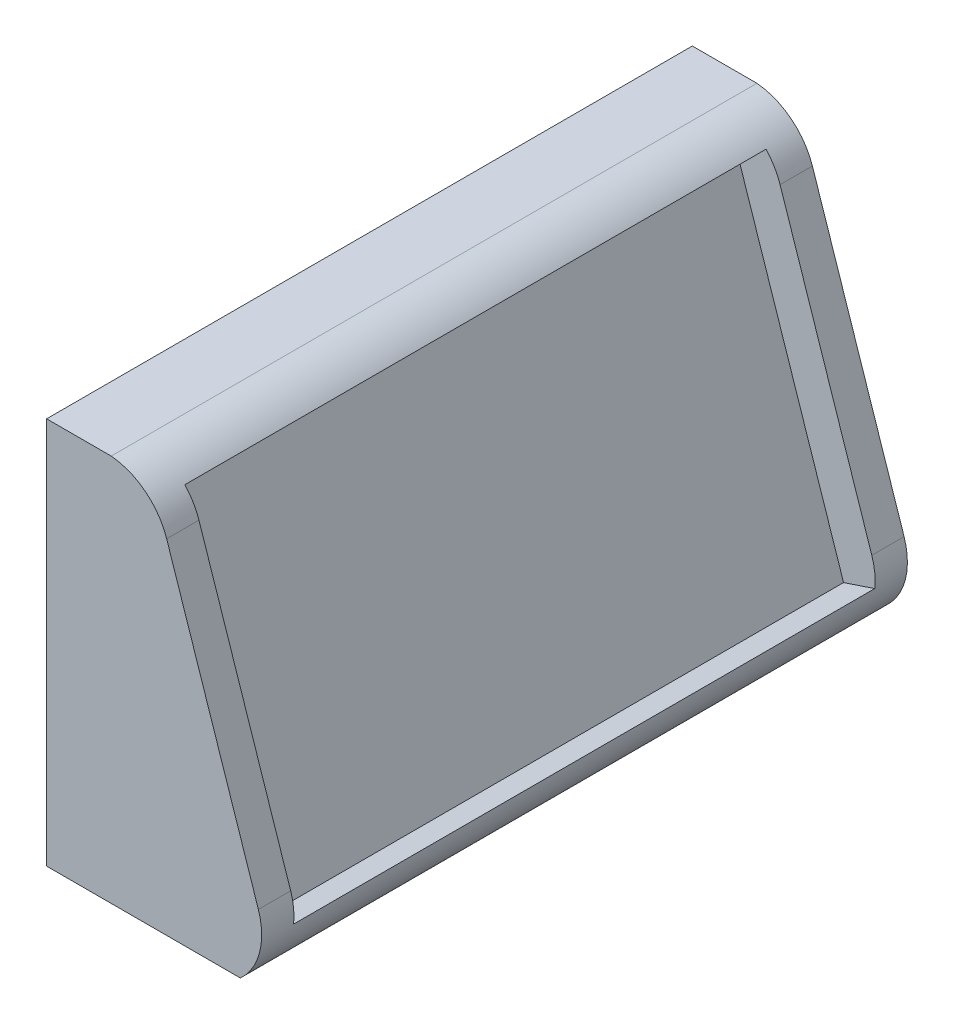
from build123d import *

# Parameters (mm, degrees)
SKETCH1_W           = 100
SKETCH1_H           = 60
BOSS_EXTRUDE1_DEPTH = 10
BOSS_EXTRUDE2_DEPTH = 100
SKETCH3_W           = 100
SKETCH3_H           = 63.245553203
SKETCH3_W_2         = 90
SKETCH3_H_2         = 53.245553203
BOSS_EXTRUDE3_DEPTH = 6
FILLET1_R           = 10
FILLET3_R           = 10


with BuildPart() as part:
    # Sketch1 → Boss-Extrude1 (new body)
    with BuildSketch(Plane(origin=(0, 0, 0), x_dir=(0, 0, -1), z_dir=(1, 0, 0))):
        Rectangle(SKETCH1_W, SKETCH1_H)
    extrude(amount=BOSS_EXTRUDE1_DEPTH)

    # Sketch2 → Boss-Extrude2 (add)
    with BuildSketch(Plane.XY.offset(50)):
        Polygon((10, 30), (30, -30), (10, -30), align=None)
    extrude(amount=-BOSS_EXTRUDE2_DEPTH)

    # Sketch3 → Boss-Extrude3 (add)
    with BuildSketch(Plane(origin=(18, 6, 0), x_dir=(0, 0, -1), z_dir=(0.9486832980505139, 0.316227766016838, 0))):
        with Locations((0, -6.324555321)):
            Rectangle(SKETCH3_W, SKETCH3_H)
        with Locations((0, -6.324555321)):
            Rectangle(SKETCH3_W_2, SKETCH3_H_2, mode=Mode.SUBTRACT)
    extrude(amount=BOSS_EXTRUDE3_DEPTH)

    # Fillet1
    # the kernel refuses this fillet: 10 mm, written as the material it takes off along each edge
    with BuildSketch(Plane(origin=(15.692099788, 31.897366596, 72.912878475), x_dir=(0.31622776601683805, -0.9486832980505137, 0), z_dir=(0, 0, -1))) as fillet1_piece_1:
        with BuildLine():
            CenterArc((9.16515139, 10), FILLET1_R, 203.578178478, 66.421821522)
            Line((0, 6), (0, 0))
            Line((0, 0), (9.16515139, 0))
        make_face()
    extrude(amount=145.82575695, mode=Mode.SUBTRACT)

    # Fillet3
    # the kernel refuses this fillet: 10 mm, written as the material it takes off along each edge
    with BuildSketch(Plane(origin=(35.692099788, -28.102633404, -72.912878475), x_dir=(-0.9486832980505142, -0.3162277660168365, 0), z_dir=(0, 0, 1))) as fillet3_piece_1:
        with BuildLine():
            CenterArc((10, -9.16515139), FILLET3_R, 113.578178478, 66.421821522)
            Line((0, -9.16515139), (-0.2, -9.16515139))
            Line((-0.2, -9.16515139), (-0.2, 0))
            Line((-0.2, 0), (0, 0.2))
            ThreePointArc((0, 0.2), (3, 0.2), (5.92, 0.183303028))
            Line((5.92, 0.183303028), (6, 0))
        make_face()
    extrude(amount=145.82575695, mode=Mode.SUBTRACT)


solid = part.part
